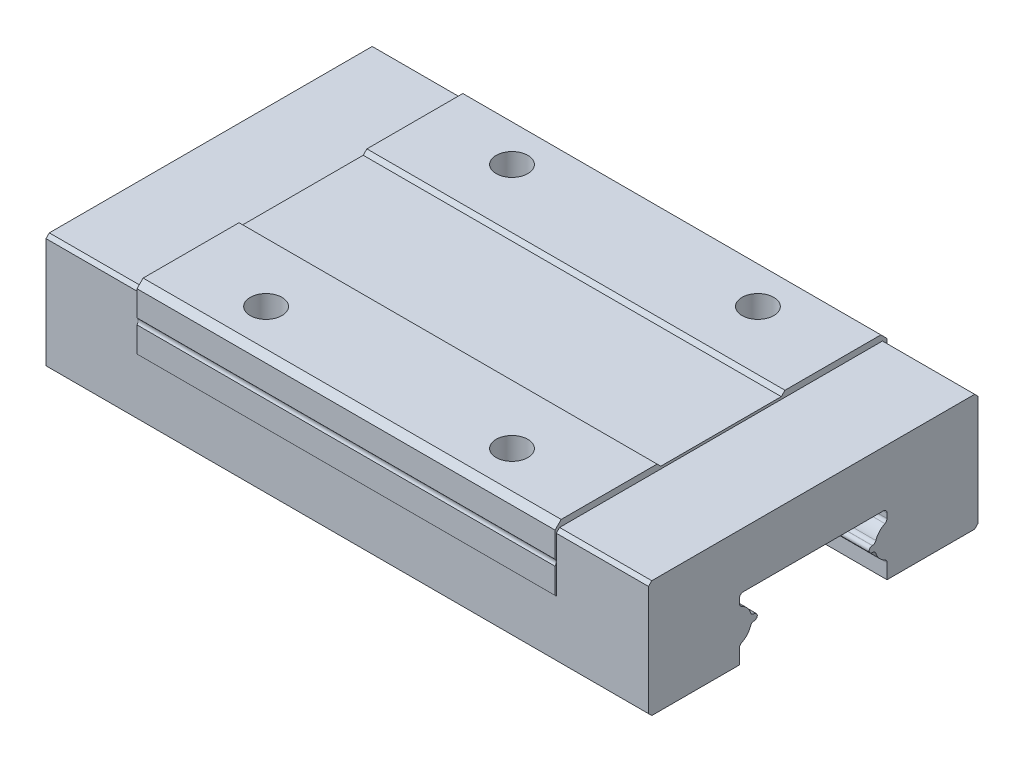
from build123d import *

# Parameters (mm, degrees)
EXTRUDE_1_DEPTH        = 49
SKETCH_2_W             = 34
SKETCH_2_H             = 4.7
EXTRUDE_2_DEPTH        = 0.1
SKETCH_3_W             = 34
SKETCH_3_H             = 4.6
EXTRUDE_3_DEPTH        = 0.1
SKETCH_4_W             = 34
SKETCH_4_H             = 27
EXTRUDE_4_DEPTH        = 0.5
CUT_EXTRUDE_1_DEPTH    = 34
SKETCH_6_W             = 9.8
SKETCH_6_H             = 0.3
CUT_EXTRUDE_2_DEPTH    = 45.558949718
DRAFT_1_ANGLE          = 45
DRAFT_2_ANGLE          = 45
DRAFT_3_ANGLE          = 45
HOLE_WIZARD_M2_1_D     = 2.58
HOLE_WIZARD_M2_1_DEPTH = 3.5
HOLE_WIZARD_M2_1_TIP   = 0.775110199
CHAMFER_1_SIZE         = 0.27
CHAMFER_2_SIZE         = 0.5
FILLET_1_R             = 0.3


with BuildPart() as part:
    # 草图1 → 凸台-拉伸1 (new body)
    with BuildSketch(Plane(origin=(-24.5, 0, 0), x_dir=(0, -1, 0), z_dir=(-1, 0, 0))):
        with BuildLine():
            Line((1, 13.4), (-8.5, 13.4))
            Line((-8.5, 13.4), (-8.5, -13.4))
            Line((-8.5, -13.4), (1, -13.4))
            Line((1, -13.4), (1, -6))
            Line((1, -6), (-0.408889, -6))
            ThreePointArc((-0.408889, -6), (-0.826571316, -5.367595703), (-1.51, -5.04))
            Line((-1.51, -5.04), (-1.51, -4.8))
            ThreePointArc((-1.51, -4.8), (-1.76, -4.55), (-2.01, -4.8))
            Line((-2.01, -4.8), (-2.01, -5.04))
            ThreePointArc((-2.01, -5.04), (-2.693428684, -5.367595703), (-3.111111, -6))
            Line((-3.111111, -6), (-4, -6))
            Line((-4, -6), (-4, 6))
            Line((-4, 6), (-3.111111, 6))
            ThreePointArc((-3.111111, 6), (-2.693428684, 5.367595703), (-2.01, 5.04))
            Line((-2.01, 5.04), (-2.01, 4.8))
            ThreePointArc((-2.01, 4.8), (-1.76, 4.55), (-1.51, 4.8))
            Line((-1.51, 4.8), (-1.51, 5.04))
            ThreePointArc((-1.51, 5.04), (-0.826571316, 5.367595703), (-0.408889, 6))
            Line((-0.408889, 6), (1, 6))
            Line((1, 6), (1, 13.4))
        make_face()
    extrude(amount=-EXTRUDE_1_DEPTH)

    # 草图2 → 凸台-拉伸2 (add)
    with BuildSketch(Plane(origin=(0, 0, -13.4), x_dir=(-1, 0, 0), z_dir=(0, 0, -1))):
        with Locations((0, 6.15)):
            Rectangle(SKETCH_2_W, SKETCH_2_H)
    extrude(amount=EXTRUDE_2_DEPTH)

    # 草图3 → 凸台-拉伸3 (add)
    with BuildSketch(Plane.XY.offset(13.4)):
        with Locations((0, 6.2)):
            Rectangle(SKETCH_3_W, SKETCH_3_H)
    extrude(amount=EXTRUDE_3_DEPTH)

    # 草图4 → 凸台-拉伸4 (add)
    with BuildSketch(Plane(origin=(0, 8.5, 0), x_dir=(-1, 0, 0), z_dir=(0, 1, 0))):
        Rectangle(SKETCH_4_W, SKETCH_4_H)
    extrude(amount=EXTRUDE_4_DEPTH)

    # 草图5 → 切除-拉伸1 (cut)
    with BuildSketch(Plane(origin=(17, 0, 0), x_dir=(0, 0, -1), z_dir=(1, 0, 0))):
        with BuildLine():
            Line((-13.5, 6.444948974), (-13.5, 5.955051026))
            ThreePointArc((-13.5, 5.955051026), (-13.4, 6.2), (-13.5, 6.444948974))
        make_face()
    extrude(amount=-CUT_EXTRUDE_1_DEPTH, mode=Mode.SUBTRACT)

    # 草图6 → 切除-拉伸2 (cut, through all)
    with BuildSketch(Plane(origin=(17, 0, 0), x_dir=(0, 0, -1), z_dir=(1, 0, 0))):
        with Locations((0, 8.85)):
            Rectangle(SKETCH_6_W, SKETCH_6_H)
    extrude(amount=-CUT_EXTRUDE_2_DEPTH, mode=Mode.SUBTRACT)

    # 拔模1
    draft_1_faces = [part.faces().sort_by_distance(p)[0] for p in [
        (0, 3.9, 13.45),
    ]]
    draft(draft_1_faces, Plane.XY.offset(13.5), DRAFT_1_ANGLE)

    # 拔模2
    draft_2_faces = [part.faces().sort_by_distance(p)[0] for p in [
        (0, 3.8, -13.45),
    ]]
    draft(draft_2_faces, Plane(origin=(24.5, 8.5, -13.4), x_dir=(-1, 0, 0), z_dir=(0, 0, -1)), DRAFT_2_ANGLE)

    # 拔模3
    draft_3_faces = [part.faces().sort_by_distance(p)[0] for p in [
        (0, 8.85, 4.9),
        (0, 8.85, -4.9),
    ]]
    draft(draft_3_faces, Plane(origin=(-24.5, 8.7, 4.9), x_dir=(0, 0, 1), z_dir=(0, 1, 0)), DRAFT_3_ANGLE)

    # M2 间隙孔1
    with Locations(Plane(origin=(0, 9, 0), x_dir=(1, 0, 0), z_dir=(0, 1, 0))):
        with Locations((10, -10), (-10, -10), (-10, 10), (10, 10)):
            Hole(HOLE_WIZARD_M2_1_D / 2, depth=HOLE_WIZARD_M2_1_DEPTH)
            with Locations((0, 0, -(HOLE_WIZARD_M2_1_DEPTH + HOLE_WIZARD_M2_1_TIP / 2))):  # 118° drill point
                Cone(0, HOLE_WIZARD_M2_1_D / 2, HOLE_WIZARD_M2_1_TIP, mode=Mode.SUBTRACT)

    # 倒角1
    chamfer_1_edges = [part.edges().sort_by_distance(p)[0] for p in [
        (0, -1, -13.4),
        (-20.75, 8.5, -13.4),
        (0, -1, 13.4),
        (-20.75, 8.5, 13.4),
        (20.75, 8.5, -13.4),
        (20.75, 8.5, 13.4),
    ]]
    chamfer(chamfer_1_edges, length=CHAMFER_1_SIZE)

    # 倒角2
    chamfer_2_edges = [part.edges().sort_by_distance(p)[0] for p in [
        (0, 9, -13.5),
        (0, 9, 13.5),
    ]]
    chamfer(chamfer_2_edges, length=CHAMFER_2_SIZE)

    # 圆角1
    fillet_1_edges = [part.edges().sort_by_distance(p)[0] for p in [
        (0, 0.408889, -6),
        (0, 0.408889, 6),
        (0, 2.01, -5.04),
        (0, 4, 6),
        (0, 3.111111, -6),
        (0, 3.111111, 6),
        (0, 1.51, -5.04),
        (0, 2.01, 5.04),
        (0, 1.51, 5.04),
        (0, 4, -6),
    ]]
    fillet(fillet_1_edges, radius=FILLET_1_R)


solid = part.part
